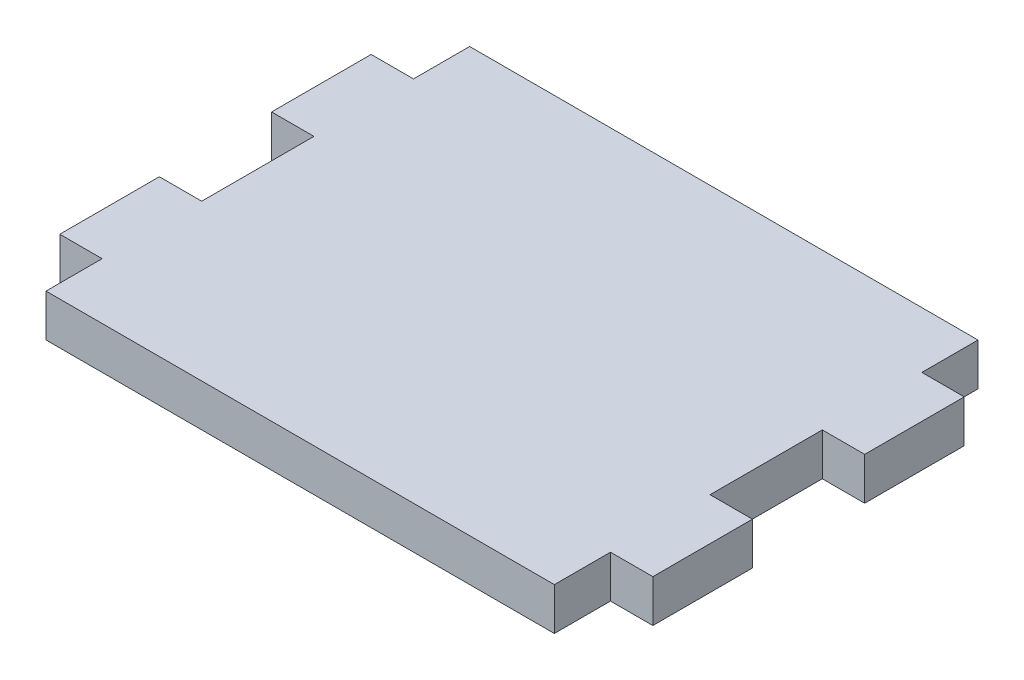
from build123d import *

# Parameters (mm, degrees)
BOSS_EXTRUDE2_DEPTH = 4


with BuildPart() as part:
    # Sketch1 → Boss-Extrude2 (new body)
    with BuildSketch(Plane(origin=(0, 0, 0), x_dir=(1, 0, 0), z_dir=(0, 1, 0))):
        Polygon((48, 40), (0, 40), (0, 34.7), (-4, 34.7), (-4, 25.3), (0, 25.3), (0, 14.7), (-4, 14.7), (-4, 5.3), (0, 5.3), (0, 0), (48, 0), (48, 5.3), (52, 5.3), (52, 14.7), (48, 14.7), (48, 25.3), (52, 25.3), (52, 34.7), (48, 34.7), align=None)
    extrude(amount=BOSS_EXTRUDE2_DEPTH)


solid = part.part
